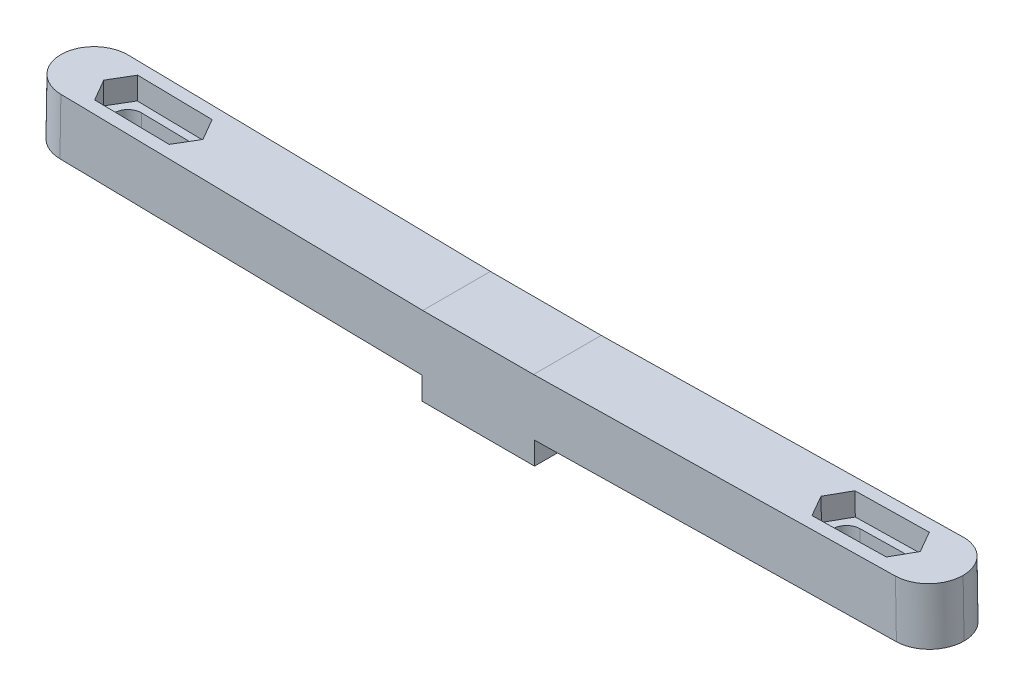
from build123d import *

# Parameters (mm, degrees)
BOSS_EXTRUDE1_DEPTH = 6
CUT_EXTRUDE1_DEPTH  = 6
CUT_EXTRUDE3_DEPTH  = 2
FILLET1_R           = 3


with BuildPart() as part:
    # Sketch1 → Boss-Extrude1 (new body)
    with BuildSketch(Plane.XY):
        Polygon((10, 0), (45.087262032, 0.612450437), (45, 5.611688913), (9.912737968, 4.999238476), (0.087262032, 4.999238476), (-35, 5.611688913), (-35.087262032, 0.612450437), (0, 0), (0, -2), (10, -2), align=None)
    extrude(amount=BOSS_EXTRUDE1_DEPTH)

    # Sketch2 → Cut-Extrude1 (cut)
    with BuildSketch(Plane(origin=(0.087262032, 4.999238476, 0), x_dir=(0.9998476951563913, -0.017452406437283737, 0), z_dir=(0.017452406437283737, 0.9998476951563913, 0))):
        with BuildLine():
            Line((-29.092606806, -4.2), (-24.692606806, -4.2))
            ThreePointArc((-24.692606806, -4.2), (-23.492606806, -3), (-24.692606806, -1.8))
            Line((-24.692606806, -1.8), (-29.092606806, -1.8))
            ThreePointArc((-29.092606806, -1.8), (-30.292606806, -3), (-29.092606806, -4.2))
        make_face()
    cut_extrude1 = extrude(amount=-CUT_EXTRUDE1_DEPTH, mode=Mode.SUBTRACT)

    # Sketch2<3> → Cut-Extrude3 (cut)
    with BuildSketch(Plane(origin=(0.087262032, 4.999238476, 0), x_dir=(0.9998476951563913, -0.017452406437283737, 0), z_dir=(0.017452406437283737, 0.9998476951563913, 0))):
        Polygon((-22.492606806, -3), (-23.592606806, -1.094744112), (-30.192606806, -1.094744112), (-31.292606806, -3), (-30.192606806, -4.905255888), (-23.592606806, -4.905255888), align=None)
        with BuildLine():
            ThreePointArc((-24.692606806, -4.2), (-23.492606806, -3), (-24.692606806, -1.8))
            Line((-24.692606806, -1.8), (-29.092606806, -1.8))
            ThreePointArc((-29.092606806, -1.8), (-30.292606806, -3), (-29.092606806, -4.2))
            Line((-29.092606806, -4.2), (-24.692606806, -4.2))
        make_face(mode=Mode.SUBTRACT)
    cut_extrude3 = extrude(amount=-CUT_EXTRUDE3_DEPTH, mode=Mode.SUBTRACT)

    # Mirror1: Cut-Extrude1, Cut-Extrude3 across plane
    add(cut_extrude1.mirror(Plane(origin=(5, 0, 0), x_dir=(0, 0, 1), z_dir=(1, 0, 0))), mode=Mode.SUBTRACT)
    add(cut_extrude3.mirror(Plane(origin=(5, 0, 0), x_dir=(0, 0, 1), z_dir=(1, 0, 0))), mode=Mode.SUBTRACT)

    # Fillet1
    fillet1_edges = [part.edges().sort_by_distance(p)[0] for p in [
        (45.043631016, 3.112069675, 0),
        (45.043631016, 3.112069675, 6),
        (-35.043631016, 3.112069675, 0),
        (-35.043631016, 3.112069675, 6),
    ]]
    fillet(fillet1_edges, radius=FILLET1_R - 0.0001)  # a hair under: the kernel refuses the full size


solid = part.part
